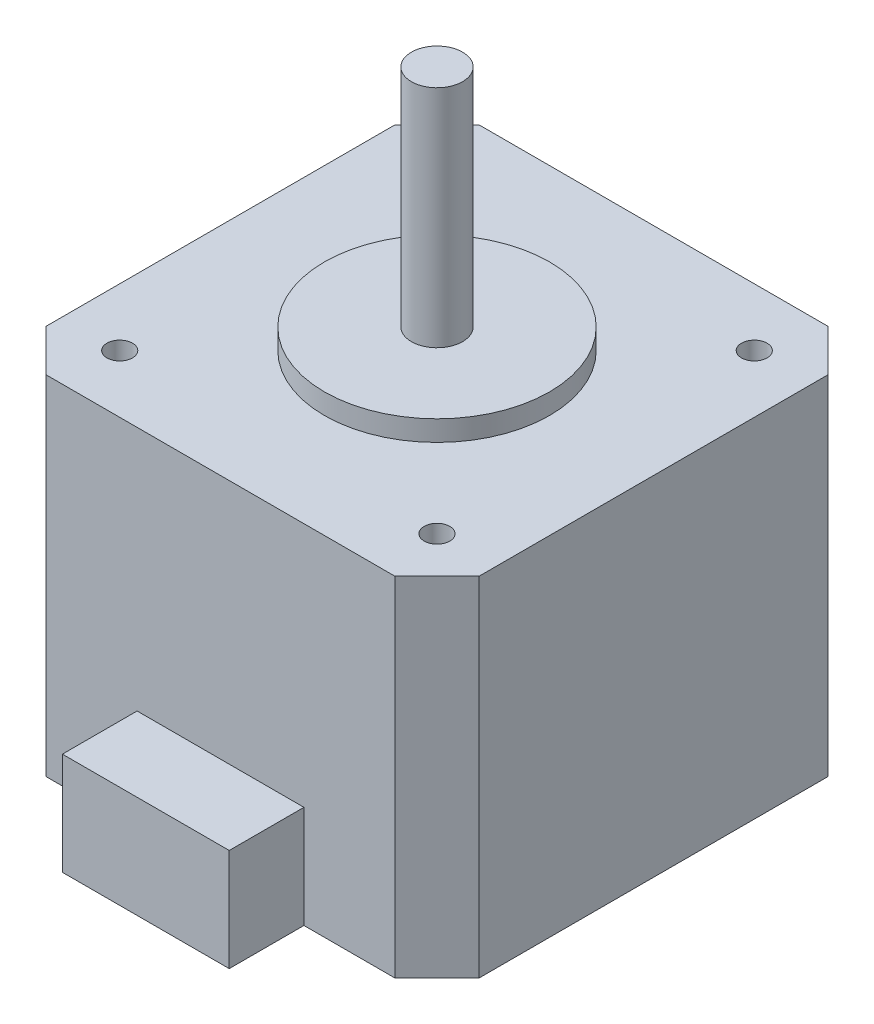
from build123d import *

# Parameters (mm, degrees)
BOSS_EXTRUDE1_DEPTH = 34
SKETCH2_R           = 11
BOSS_EXTRUDE2_DEPTH = 2
SKETCH3_R           = 2.5
BOSS_EXTRUDE3_DEPTH = 24
SKETCH8_W           = 16.3
SKETCH8_H           = 10
BOSS_EXTRUDE4_DEPTH = 7.3


# Read off the part's stored shape, not the designer's step: M3 Tapped Hole1
with BuildPart() as part:
    # Sketch1 → Boss-Extrude1 (new body)
    with BuildSketch(Plane(origin=(0, 0, 0), x_dir=(1, 0, 0), z_dir=(0, 1, 0))):
        Polygon((-17.033766184, 21.15), (17.033766184, 21.15), (21.15, 17.033766184), (21.15, -17.033766184), (17.033766184, -21.15), (-17.033766184, -21.15), (-21.15, -17.033766184), (-21.15, 17.033766184), align=None)
    extrude(amount=BOSS_EXTRUDE1_DEPTH)

    # Sketch2 → Boss-Extrude2 (add)
    with BuildSketch(Plane(origin=(0, 34, 0), x_dir=(1, 0, 0), z_dir=(0, 1, 0))):
        with Locations(Location((0, 0, 0), (0, 0, 270))):
            Circle(SKETCH2_R)
    extrude(amount=BOSS_EXTRUDE2_DEPTH)

    # Sketch3 → Boss-Extrude3 (add)
    with BuildSketch(Plane(origin=(0, 34, 0), x_dir=(1, 0, 0), z_dir=(0, 1, 0))):
        with Locations(Location((0, 0, 0), (0, 0, 270))):
            Circle(SKETCH3_R)
    extrude(amount=BOSS_EXTRUDE3_DEPTH)

    # M3 Tapped Hole1 outline → M3 Tapped Hole1 (revolve, cut)
    with BuildSketch(Plane(origin=(15.5, 0, -15.5), x_dir=(1, 0, 0), z_dir=(0, 0, 1))):
        Polygon((0, 34), (0, 28.748924226), (1.25, 29.5), (1.25, 34), align=None)
    revolve(axis=Axis((15.5, 0, -15.5), (0, 1, 0)), mode=Mode.SUBTRACT)

    # M3 Tapped Hole1 2 outline → M3 Tapped Hole1 2 (revolve, cut)
    with BuildSketch(Plane(origin=(-15.5, 0, 15.5), x_dir=(1, 0, 0), z_dir=(0, 0, 1))):
        Polygon((0, 34), (0, 28.748924226), (1.25, 29.5), (1.25, 34), align=None)
    revolve(axis=Axis((-15.5, 0, 15.5), (0, 1, 0)), mode=Mode.SUBTRACT)

    # M3 Tapped Hole1 3 outline → M3 Tapped Hole1 3 (revolve, cut)
    with BuildSketch(Plane(origin=(15.5, 0, 15.5), x_dir=(1, 0, 0), z_dir=(0, 0, 1))):
        Polygon((0, 34), (0, 28.748924226), (1.25, 29.5), (1.25, 34), align=None)
    revolve(axis=Axis((15.5, 0, 15.5), (0, 1, 0)), mode=Mode.SUBTRACT)

    # M3 Tapped Hole1 4 outline → M3 Tapped Hole1 4 (revolve, cut)
    with BuildSketch(Plane(origin=(-15.5, 0, -15.5), x_dir=(1, 0, 0), z_dir=(0, 0, 1))):
        Polygon((0, 34), (0, 28.748924226), (1.25, 29.5), (1.25, 34), align=None)
    revolve(axis=Axis((-15.5, 0, -15.5), (0, 1, 0)), mode=Mode.SUBTRACT)

    # Sketch8 → Boss-Extrude4 (add)
    with BuildSketch(Plane.XY.offset(21.15)):
        with Locations((0, 5)):
            Rectangle(SKETCH8_W, SKETCH8_H)
    extrude(amount=BOSS_EXTRUDE4_DEPTH)


solid = part.part
